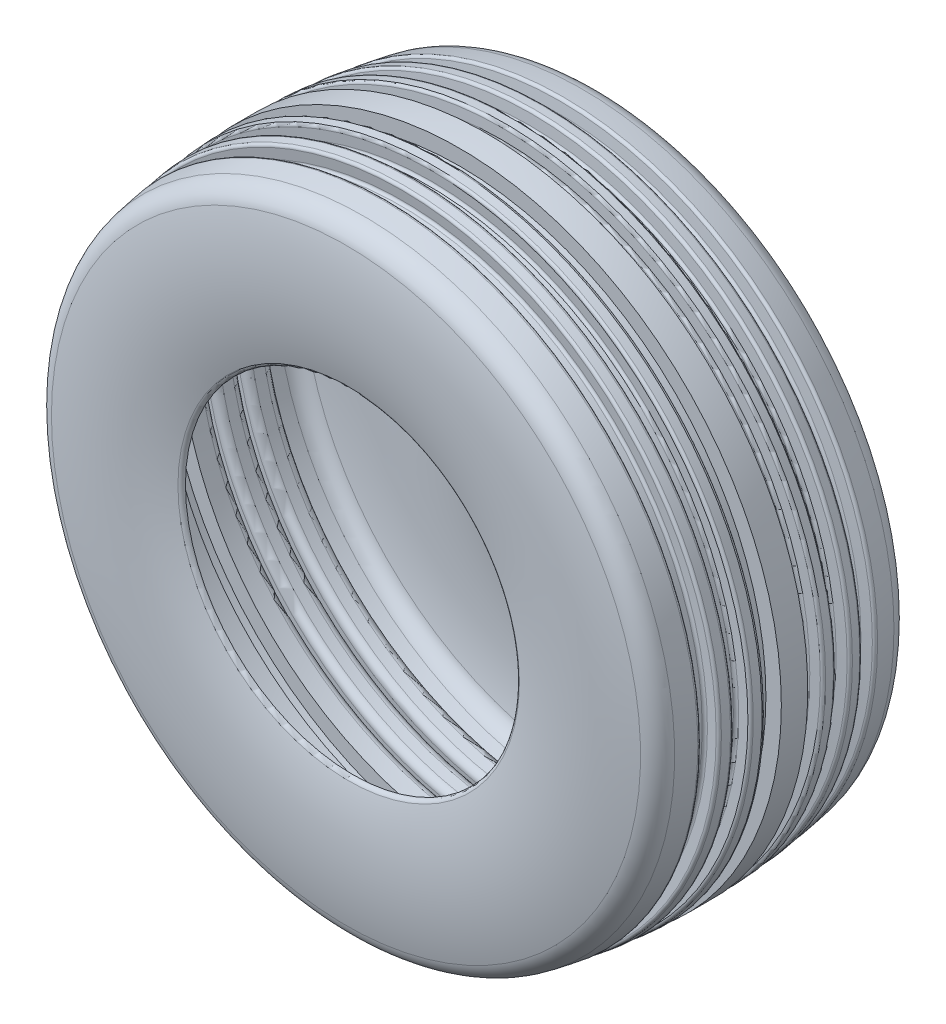
from build123d import *

# Parameters (mm, degrees)
FILLET1_R            = 6
FILLET2_R            = 6
FILLET1_OF_MIRROR1_R = 6
FILLET2_OF_MIRROR1_R = 6
FILLET3_R            = 50
FILLET4_R            = 10


# Read off the part's stored shape, not the designer's step: Cut-Revolve-Thin1, Shell1
with BuildPart() as part:
    # Sketch1 → Revolve1 (revolve)
    with BuildSketch(Plane(origin=(0, 0, 0), x_dir=(0, 0, -1), z_dir=(1, 0, 0)), mode=Mode.PRIVATE) as revolve1_sk:
        with BuildLine():
            Line((-280, 380), (280, 380))
            ThreePointArc((280, 380), (302.505605409, 540), (280, 700))
            ThreePointArc((280, 700), (0, 730), (-280, 700))
            ThreePointArc((-280, 700), (-302.505605409, 540), (-280, 380))
        make_face()
    revolve(revolve1_sk.sketch.rotate(Axis((0, 0, 583.128216784), (0, 0, -1)), 90), axis=Axis((0, 0, 583.128216784), (0, 0, -1)))

    # Cut-Revolve-Thin1 outline → Cut-Revolve-Thin1 (revolve, cut)
    with BuildSketch(Plane.XZ):
        with BuildLine():
            ThreePointArc((693.379032014, 64.565187316), (694.130775963, 47.286865379), (694.650211521, 30))
            Line((694.650211521, 30), (729.65947694, 30))
            Line((729.65947694, 30), (729.65947694, 66.049806803))
            Line((729.65947694, 66.049806803), (728.348560821, 66.049806803))
            Line((728.348560821, 66.049806803), (693.379032014, 64.565187316))
        make_face()
        with BuildLine():
            Line((726.43168337, 97.054198299), (726.43168337, 132.209624738))
            Line((726.43168337, 132.209624738), (723.370744552, 132.209624738))
            Line((723.370744552, 132.209624738), (688.519780387, 128.971981028))
            ThreePointArc((688.519780387, 128.971981028), (690.150467529, 111.60620768), (691.545598274, 94.219924732))
            Line((691.545598274, 94.219924732), (726.43168337, 97.054198299))
        make_face()
        with BuildLine():
            Line((685.212145445, 158.403315279), (719.912377901, 162.982169668))
            Line((719.912377901, 162.982169668), (719.912377901, 197.9400469))
            Line((719.912377901, 197.9400469), (715.093646325, 197.9400469))
            Line((715.093646325, 197.9400469), (680.448703554, 192.96008903))
            ThreePointArc((680.448703554, 192.96008903), (682.947540866, 175.697845936), (685.212145445, 158.403315279))
        make_face()
    cut_revolve_thin1 = revolve(axis=Axis((0, 0, 0), (0, 0, 1)), mode=Mode.SUBTRACT)

    # Fillet1
    fillet1_edges = [part.edges().sort_by_distance(p)[0] for p in [
        (-715.093646325, 0, 197.9400469),
        (-719.912377901, 0, 162.982169668),
        (-723.370744552, 0, 132.209624738),
        (-726.43168337, 0, 97.054198299),
        (-728.348560821, 0, 66.049806803),
    ]]
    fillet(fillet1_edges, radius=FILLET1_R)

    # Fillet2
    fillet2_edges = [part.edges().sort_by_distance(p)[0] for p in [
        (-685.212145445, 0, 158.403315279),
        (-680.448703554, 0, 192.96008903),
        (-691.545598274, 0, 94.219924732),
        (-688.519780387, 0, 128.971981028),
        (-693.379032014, 0, 64.565187316),
    ]]
    fillet(fillet2_edges, radius=FILLET2_R)

    # Mirror1: Cut-Revolve-Thin1 across plane
    add(cut_revolve_thin1.mirror(Plane.XY), mode=Mode.SUBTRACT)

    # Fillet1 of Mirror1
    fillet1_of_mirror1_edges = [part.edges().sort_by_distance(p)[0] for p in [
        (-715.093646325, 0, -197.9400469),
        (-719.912377901, 0, -162.982169668),
        (-723.370744552, 0, -132.209624738),
        (-726.43168337, 0, -97.054198299),
        (-728.348560821, 0, -66.049806803),
    ]]
    fillet(fillet1_of_mirror1_edges, radius=FILLET1_OF_MIRROR1_R)

    # Fillet2 of Mirror1
    fillet2_of_mirror1_edges = [part.edges().sort_by_distance(p)[0] for p in [
        (-685.212145445, 0, -158.403315279),
        (-680.448703554, 0, -192.96008903),
        (-691.545598274, 0, -94.219924732),
        (-688.519780387, 0, -128.971981028),
        (-693.379032014, 0, -64.565187316),
    ]]
    fillet(fillet2_of_mirror1_edges, radius=FILLET2_OF_MIRROR1_R)

    # Fillet3
    fillet3_edges = [part.edges().sort_by_distance(p)[0] for p in [
        (-700, 0, -280),
        (-700, 0, 280),
    ]]
    fillet(fillet3_edges, radius=FILLET3_R)

    # Fillet4
    fillet4_edges = [part.edges().sort_by_distance(p)[0] for p in [
        (-380, 0, 280),
        (-380, 0, -280),
    ]]
    fillet(fillet4_edges, radius=FILLET4_R)

    # Shell1 outline → Shell1 (revolve, cut)
    with BuildSketch(Plane.XZ):
        with BuildLine():
            Line((390, 272.414688804), (380, 272.414688804))
            Line((380, 272.414688804), (380, -272.414688804))
            Line((380, -272.414688804), (390, -272.414688804))
            ThreePointArc((390, -272.414688804), (527.692703475, -292.372721896), (666.118678014, -278.37796401))
            ThreePointArc((666.118678014, -278.37796401), (686.025689279, -267.172423462), (696.553222015, -246.898689445))
            ThreePointArc((696.553222015, -246.898689445), (700.264863332, -226.676788047), (703.659090413, -206.399194502))
            Line((703.659090413, -206.399194502), (684.997198231, -203.716683595))
            ThreePointArc((684.997198231, -203.716683595), (674.450537414, -197.448521985), (671.443581141, -185.553980449))
            ThreePointArc((671.443581141, -185.553980449), (673.041212828, -174.332318636), (674.539151585, -163.096914757))
            ThreePointArc((674.539151585, -163.096914757), (680.652003783, -152.459483564), (692.501178601, -149.278452205))
            Line((692.501178601, -149.278452205), (711.192853199, -151.744904162))
            ThreePointArc((711.192853199, -151.744904162), (711.794248036, -146.489208769), (712.374441647, -141.231130681))
            Line((712.374441647, -141.231130681), (693.6015737, -139.487137099))
            ThreePointArc((693.6015737, -139.487137099), (682.754065059, -133.755343255), (679.154851009, -122.026423331))
            ThreePointArc((679.154851009, -122.026423331), (680.188158196, -110.738801921), (681.121209082, -99.44245132))
            ThreePointArc((681.121209082, -99.44245132), (686.693340124, -88.512068892), (698.368227423, -84.74127177))
            Line((698.368227423, -84.74127177), (717.160013659, -86.26798544))
            ThreePointArc((717.160013659, -86.26798544), (717.500271268, -80.940552652), (717.818844247, -75.611779191))
            Line((717.818844247, -75.611779191), (698.982110108, -74.81207203))
            ThreePointArc((698.982110108, -74.81207203), (687.860627477, -69.631866584), (683.677349644, -58.098346265))
            ThreePointArc((683.677349644, -58.098346265), (684.402532075, -39.053524825), (684.843332424, -20))
            Line((684.843332424, -20), (719.847513373, -20))
            ThreePointArc((719.847513373, -20), (720, 0), (719.847513373, 20))
            Line((719.847513373, 20), (684.843332424, 20))
            ThreePointArc((684.843332424, 20), (684.402532075, 39.053524825), (683.677349644, 58.098346265))
            ThreePointArc((683.677349644, 58.098346265), (687.860627477, 69.631866584), (698.982110108, 74.81207203))
            Line((698.982110108, 74.81207203), (717.818844247, 75.611779191))
            ThreePointArc((717.818844247, 75.611779191), (717.500271268, 80.940552652), (717.160013659, 86.26798544))
            Line((717.160013659, 86.26798544), (698.368227423, 84.74127177))
            ThreePointArc((698.368227423, 84.74127177), (686.693340124, 88.512068892), (681.121209082, 99.44245132))
            ThreePointArc((681.121209082, 99.44245132), (680.188158196, 110.738801921), (679.154851009, 122.026423331))
            ThreePointArc((679.154851009, 122.026423331), (682.754065059, 133.755343255), (693.6015737, 139.487137099))
            Line((693.6015737, 139.487137099), (712.374441647, 141.231130681))
            ThreePointArc((712.374441647, 141.231130681), (711.794248036, 146.489208769), (711.192853199, 151.744904162))
            Line((711.192853199, 151.744904162), (692.501178601, 149.278452205))
            ThreePointArc((692.501178601, 149.278452205), (680.652003783, 152.459483564), (674.539151585, 163.096914757))
            ThreePointArc((674.539151585, 163.096914757), (673.041212828, 174.332318636), (671.443581141, 185.553980449))
            ThreePointArc((671.443581141, 185.553980449), (674.450537414, 197.448521985), (684.997198231, 203.716683595))
            Line((684.997198231, 203.716683595), (703.659090413, 206.399194502))
            ThreePointArc((703.659090413, 206.399194502), (700.264863332, 226.676788047), (696.553222015, 246.898689445))
            ThreePointArc((696.553222015, 246.898689445), (686.025689279, 267.172423462), (666.118678014, 278.37796401))
            ThreePointArc((666.118678014, 278.37796401), (527.692703475, 292.372721896), (390, 272.414688804))
        make_face()
    revolve(axis=Axis((0, 0, 0), (0, 0, 1)), mode=Mode.SUBTRACT)


solid = part.part
